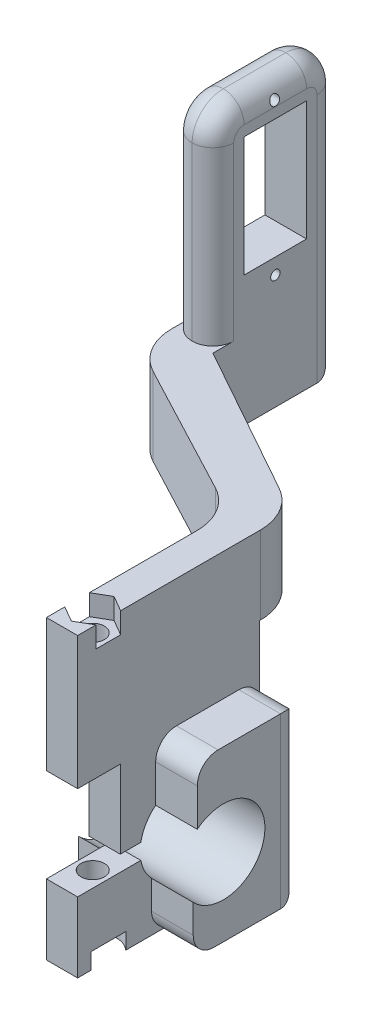
from build123d import *

# Parameters (mm, degrees)
SKETCH1_R                                        = 0.9
SKETCH1_W                                        = 12
SKETCH1_H                                        = 23
BOSS_EXTRUDE1_DEPTH                              = 42
CBORE_FOR_M4_PAN_HEAD_MACHINE_SCREW2_D           = 4.5
CBORE_FOR_M4_PAN_HEAD_MACHINE_SCREW2_CBORE_D     = 9
CBORE_FOR_M4_PAN_HEAD_MACHINE_SCREW2_CBORE_DEPTH = 3.1
CUT_EXTRUDE2_DEPTH                               = 4
SKETCH11_W                                       = 35
SKETCH11_H                                       = 57
CUT_EXTRUDE3_DEPTH                               = 36
SKETCH12_W                                       = 24
SKETCH12_H                                       = 54
CUT_EXTRUDE4_DEPTH                               = 34
BOSS_EXTRUDE2_DEPTH                              = 8
BOSS_EXTRUDE2_DEPTH_BACK                         = 14
FILLET3_R                                        = 4
SKETCH14_W                                       = 8.2
SKETCH14_H                                       = 15
CUT_EXTRUDE5_DEPTH                               = 92.094527719
FILLET4_R                                        = 6
FILLET5_R                                        = 4
CUT_EXTRUDE6_DEPTH                               = 94.87574371
FILLET6_R                                        = 10


with BuildPart() as part:
    # Sketch1 → Boss-Extrude1 (new body)
    with BuildSketch(Plane(origin=(0, 0, 0), x_dir=(0, 0, -1), z_dir=(1, 0, 0))):
        with BuildLine():
            Line((-55.350295908, -42.411439664), (-43.208412731, -42.411439664))
            ThreePointArc((-43.208412731, -42.411439664), (-27.350295908, -43.911439664), (-43.208412731, -45.411439664))
            Line((-43.208412731, -45.411439664), (-55.350295908, -45.411439664))
            Line((-55.350295908, -45.411439664), (-55.350295908, -58.911439664))
            Line((-55.350295908, -58.911439664), (-20.350295908, -58.911439664))
            Line((-20.350295908, -58.911439664), (-20.350295908, -16.911439664))
            Line((-20.350295908, -16.911439664), (28.649704092, -16.911439664))
            Line((28.649704092, -16.911439664), (28.649704092, 37.088560336))
            Line((28.649704092, 37.088560336), (4.649704092, 37.088560336))
            Line((4.649704092, 37.088560336), (4.649704092, -1.911439664))
            Line((4.649704092, -1.911439664), (-55.350295908, -1.911439664))
            Line((-55.350295908, -1.911439664), (-55.350295908, -28.911439664))
            Line((-55.350295908, -28.911439664), (-55.350295908, -42.411439664))
        make_face()
        with Locations(Location((16.649704092, 34.088560336, 0), (0, 0, 180))):
            Circle(SKETCH1_R, mode=Mode.SUBTRACT)
        with Locations(Location((16.649704092, 5.088560336, 0), (0, 0, 180))):
            Circle(SKETCH1_R, mode=Mode.SUBTRACT)
        with Locations((16.649704092, 19.588560336)):
            Rectangle(SKETCH1_W, SKETCH1_H, mode=Mode.SUBTRACT)
    extrude(amount=BOSS_EXTRUDE1_DEPTH)

    # CBORE for M4 Pan Head Machine Screw2 (through all)
    with Locations(Plane(origin=(0, -58.911439664, 0), x_dir=(-1, 0, 0), z_dir=(0, -1, 0))):
        with Locations((-39, -49.450295908)):
            CounterBoreHole(CBORE_FOR_M4_PAN_HEAD_MACHINE_SCREW2_D / 2, CBORE_FOR_M4_PAN_HEAD_MACHINE_SCREW2_CBORE_D / 2, CBORE_FOR_M4_PAN_HEAD_MACHINE_SCREW2_CBORE_DEPTH)

    # Sketch7 → Cut-Extrude2 (cut)
    with BuildSketch(Plane(origin=(0, -1.911439664, 0), x_dir=(1, 0, 0), z_dir=(0, 1, 0))):
        Polygon((42.55, -51.499889363), (42.55, -47.400702452), (39, -45.351108997), (35.45, -47.400702452), (35.45, -51.499889363), (39, -53.549482819), align=None)
    extrude(amount=-CUT_EXTRUDE2_DEPTH, mode=Mode.SUBTRACT)

    # Sketch11 → Cut-Extrude3 (cut)
    with BuildSketch(Plane.ZY):
        with Locations((37.850295908, -30.411439664)):
            Rectangle(SKETCH11_W, SKETCH11_H)
    extrude(amount=-CUT_EXTRUDE3_DEPTH, mode=Mode.SUBTRACT)

    # Sketch12 → Cut-Extrude4 (cut)
    with BuildSketch(Plane(origin=(42, 0, 0), x_dir=(0, 0, -1), z_dir=(1, 0, 0))):
        with Locations((16.649704092, 10.088560336)):
            Rectangle(SKETCH12_W, SKETCH12_H)
    extrude(amount=-CUT_EXTRUDE4_DEPTH, mode=Mode.SUBTRACT)

    # Sketch13 → Boss-Extrude2 (add, two sides: drawn at the far end of the back side and taken through both)
    with BuildSketch(Plane.ZY.offset(-36).offset(-BOSS_EXTRUDE2_DEPTH_BACK)):
        with BuildLine():
            Line((40.350295908, -37.666441665), (40.350295908, -26.440452892))
            Line((40.350295908, -26.440452892), (20.350295908, -26.440452892))
            Line((20.350295908, -26.440452892), (20.350295908, -58.911439664))
            Line((20.350295908, -58.911439664), (41.134513551, -58.911439664))
            Line((41.134513551, -58.911439664), (41.134513551, -49.437996119))
            ThreePointArc((41.134513551, -49.437996119), (27.36798978, -44.443218651), (40.350295908, -37.666441665))
        make_face()
    extrude(amount=BOSS_EXTRUDE2_DEPTH + BOSS_EXTRUDE2_DEPTH_BACK)

    # Fillet3
    fillet3_edges = [part.edges().sort_by_distance(p)[0] for p in [
        (32, -58.911439664, 41.134513551),
        (32, -26.440452892, 20.350295908),
        (32, -26.440452892, 40.350295908),
        (46, -58.911439664, 41.134513551),
        (50, -42.675946278, 20.350295908),
        (46, -26.440452892, 20.350295908),
        (46, -26.440452892, 40.350295908),
        (28, -42.675946278, 20.350295908),
        (39, -58.911439664, 20.350295908),
    ]]
    fillet(fillet3_edges, radius=FILLET3_R)

    # Sketch14 → Cut-Extrude5 (cut, through all)
    with BuildSketch(Plane(origin=(42, 0, 0), x_dir=(0, 0, -1), z_dir=(1, 0, 0))):
        with Locations((-51.250295908, -34.911439664)):
            Rectangle(SKETCH14_W, SKETCH14_H)
    extrude(amount=-CUT_EXTRUDE5_DEPTH, mode=Mode.SUBTRACT)

    # Fillet4
    fillet4_edges = [part.edges().sort_by_distance(p)[0] for p in [
        (4, 37.088560336, -4.649704092),
        (4, 37.088560336, -28.649704092),
    ]]
    fillet(fillet4_edges, radius=FILLET4_R)

    # Fillet5
    # the kernel refuses this fillet: 4 mm, written as the material it takes off along each edge
    with BuildSketch(Plane(origin=(0, 31.088560336, -4.649704092), x_dir=(0, 0, -1), z_dir=(0, -1, 0))) as fillet5_piece_1:
        with BuildLine():
            CenterArc((FILLET5_R, FILLET5_R), FILLET5_R, 180, 90)
            Line((0, FILLET5_R), (0, 0))
            Line((0, 0), (FILLET5_R, 0))
        make_face()
    extrude(amount=33, mode=Mode.SUBTRACT)
    with BuildSketch(Plane(origin=(0, 31.088560336, -10.649704092), x_dir=(0, 0, 1), z_dir=(0, -1, 0))) as fillet5_piece_2:
        with BuildLine():
            CenterArc((6 - FILLET5_R, -FILLET5_R), FILLET5_R, 0, 90)
            Line((6, -FILLET5_R), (6, 0))
            Line((6, 0), (6 - FILLET5_R, 0))
        make_face()
    revolve(axis=Axis((0, 31.088560336, -10.649704092), (-1, 0, 0)), revolution_arc=90, mode=Mode.SUBTRACT)
    with BuildSketch(Plane(origin=(0, 37.088560336, -22.649704092), x_dir=(0, -1, 0), z_dir=(0, 0, 1))) as fillet5_piece_3:
        with BuildLine():
            CenterArc((FILLET5_R, FILLET5_R), FILLET5_R, 180, 90)
            Line((0, FILLET5_R), (0, 0))
            Line((0, 0), (FILLET5_R, 0))
        make_face()
    extrude(amount=12, mode=Mode.SUBTRACT)
    with BuildSketch(Plane(origin=(0, 31.088560336, -22.649704092), x_dir=(0, 0, -1), z_dir=(0, -1, 0))) as fillet5_piece_4:
        with BuildLine():
            CenterArc((6 - FILLET5_R, FILLET5_R), FILLET5_R, 270, 90)
            Line((6, FILLET5_R), (6, 0))
            Line((6, 0), (6 - FILLET5_R, 0))
        make_face()
    revolve(axis=Axis((0, 31.088560336, -22.649704092), (1, 0, 0)), revolution_arc=90, mode=Mode.SUBTRACT)
    with BuildSketch(Plane(origin=(8, -1.911439664, -4.649704092), x_dir=(-1, 0, 0), z_dir=(0, 1, 0))) as fillet5_piece_5:
        with BuildLine():
            CenterArc((FILLET5_R, -FILLET5_R), FILLET5_R, 90, 90)
            Line((0, -FILLET5_R), (0, 0))
            Line((0, 0), (FILLET5_R, 0))
        make_face()
    extrude(amount=33, mode=Mode.SUBTRACT)
    with BuildSketch(Plane(origin=(8, 31.088560336, -10.649704092), x_dir=(0, 0, 1), z_dir=(0, -1, 0))) as fillet5_piece_6:
        with BuildLine():
            CenterArc((6 - FILLET5_R, FILLET5_R), FILLET5_R, 270, 90)
            Line((6 - FILLET5_R, 0), (6, 0))
            Line((6, 0), (6, FILLET5_R))
        make_face()
    revolve(axis=Axis((8, 31.088560336, -10.649704092), (-1, 0, 0)), revolution_arc=90, mode=Mode.SUBTRACT)
    with BuildSketch(Plane(origin=(8, 37.088560336, -10.649704092), x_dir=(-1, 0, 0), z_dir=(0, 0, -1))) as fillet5_piece_7:
        with BuildLine():
            CenterArc((FILLET5_R, -FILLET5_R), FILLET5_R, 90, 90)
            Line((0, -FILLET5_R), (0, 0))
            Line((0, 0), (FILLET5_R, 0))
        make_face()
    extrude(amount=12, mode=Mode.SUBTRACT)
    with BuildSketch(Plane(origin=(8, 31.088560336, -22.649704092), x_dir=(0, 0, -1), z_dir=(0, -1, 0))) as fillet5_piece_8:
        with BuildLine():
            CenterArc((6 - FILLET5_R, -FILLET5_R), FILLET5_R, 0, 90)
            Line((6 - FILLET5_R, 0), (6, 0))
            Line((6, 0), (6, -FILLET5_R))
        make_face()
    revolve(axis=Axis((8, 31.088560336, -22.649704092), (1, 0, 0)), revolution_arc=90, mode=Mode.SUBTRACT)
    with BuildSketch(Plane(origin=(0, -26.911439664, -28.649704092), x_dir=(0, 0, 1), z_dir=(0, 1, 0))) as fillet5_piece_9:
        with BuildLine():
            CenterArc((FILLET5_R, FILLET5_R), FILLET5_R, 180, 90)
            Line((0, FILLET5_R), (0, 0))
            Line((0, 0), (FILLET5_R, 0))
        make_face()
    extrude(amount=58, mode=Mode.SUBTRACT)
    with BuildSketch(Plane(origin=(8, 31.088560336, -28.649704092), x_dir=(-1, 0, 0), z_dir=(0, -1, 0))) as fillet5_piece_10:
        with BuildLine():
            CenterArc((FILLET5_R, -FILLET5_R), FILLET5_R, 90, 90)
            Line((0, -FILLET5_R), (0, 0))
            Line((0, 0), (FILLET5_R, 0))
        make_face()
    extrude(amount=58, mode=Mode.SUBTRACT)
    with BuildSketch(Plane(origin=(-10, -16.911439664, -28.649704092), x_dir=(0, 1, 0), z_dir=(1, 0, 0))) as fillet5_piece_11:
        with BuildLine():
            CenterArc((FILLET5_R, FILLET5_R), FILLET5_R, 180, 90)
            Line((0, FILLET5_R), (0, 0))
            Line((0, 0), (FILLET5_R, 0))
        make_face()
    extrude(amount=28, mode=Mode.SUBTRACT)

    # Sketch15 → Cut-Extrude6 (cut, through all)
    with BuildSketch(Plane(origin=(0, -1.911439664, 0), x_dir=(1, 0, 0), z_dir=(0, 1, 0))):
        Polygon((36, -20.350295908), (0, -1.350295908), (0, -20.350295908), align=None)
        Polygon((8, 4.649704092), (42, -14.350295908), (42, 4.649704092), align=None)
    extrude(amount=-CUT_EXTRUDE6_DEPTH, mode=Mode.SUBTRACT)

    # Fillet6
    fillet6_edges = [part.edges().sort_by_distance(p)[0] for p in [
        (36, -9.411439664, 20.350295908),
        (0, -9.411439664, 1.350295908),
        (42, -9.411439664, 14.350295908),
    ]]
    fillet(fillet6_edges, radius=FILLET6_R)


solid = part.part
